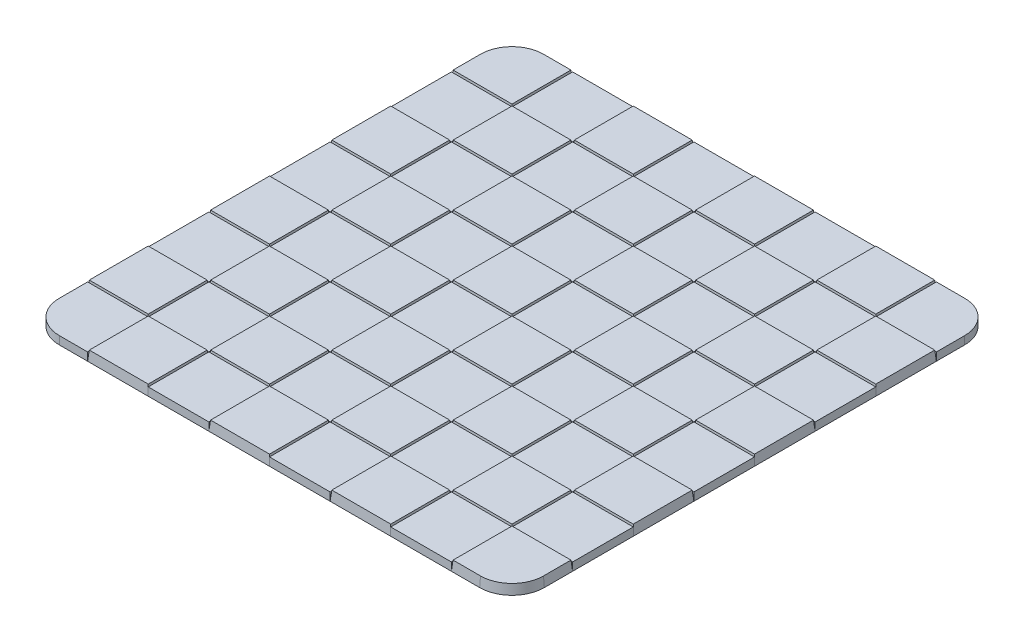
from build123d import *

# Parameters (mm, degrees)
SKETCH2_W              = 19.05
SKETCH2_H              = 19.05
BOSS_EXTRUDE1_DEPTH    = 2.54
BOSS_EXTRUDE1_2_DEPTH  = 2.54
BOSS_EXTRUDE1_3_DEPTH  = 2.54
BOSS_EXTRUDE1_4_DEPTH  = 2.54
BOSS_EXTRUDE1_5_DEPTH  = 2.54
BOSS_EXTRUDE1_6_DEPTH  = 2.54
BOSS_EXTRUDE1_7_DEPTH  = 2.54
BOSS_EXTRUDE1_8_DEPTH  = 2.54
BOSS_EXTRUDE1_9_DEPTH  = 2.54
BOSS_EXTRUDE1_10_DEPTH = 2.54
BOSS_EXTRUDE1_11_DEPTH = 2.54
BOSS_EXTRUDE1_12_DEPTH = 2.54
BOSS_EXTRUDE1_13_DEPTH = 2.54
BOSS_EXTRUDE1_14_DEPTH = 2.54
BOSS_EXTRUDE1_15_DEPTH = 2.54
BOSS_EXTRUDE1_16_DEPTH = 2.54
BOSS_EXTRUDE1_17_DEPTH = 2.54
BOSS_EXTRUDE1_18_DEPTH = 2.54
BOSS_EXTRUDE1_19_DEPTH = 2.54
BOSS_EXTRUDE1_20_DEPTH = 2.54
BOSS_EXTRUDE1_21_DEPTH = 2.54
BOSS_EXTRUDE1_22_DEPTH = 2.54
BOSS_EXTRUDE1_23_DEPTH = 2.54
BOSS_EXTRUDE1_24_DEPTH = 2.54
BOSS_EXTRUDE1_25_DEPTH = 2.54
BOSS_EXTRUDE1_26_DEPTH = 2.54
BOSS_EXTRUDE1_27_DEPTH = 2.54
BOSS_EXTRUDE1_28_DEPTH = 2.54
BOSS_EXTRUDE1_29_DEPTH = 2.54
BOSS_EXTRUDE1_30_DEPTH = 2.54
BOSS_EXTRUDE1_31_DEPTH = 2.54
BOSS_EXTRUDE1_32_DEPTH = 2.54
BOSS_EXTRUDE3_DEPTH    = 3.048
BOSS_EXTRUDE3_TAPER    = 5
SKETCH2_5_W            = 19.05
SKETCH2_5_H            = 19.05
BOSS_EXTRUDE3_2_DEPTH  = 3.048
BOSS_EXTRUDE3_2_TAPER  = 5
BOSS_EXTRUDE3_3_DEPTH  = 3.048
BOSS_EXTRUDE3_3_TAPER  = 5
BOSS_EXTRUDE3_4_DEPTH  = 3.048
BOSS_EXTRUDE3_4_TAPER  = 5
BOSS_EXTRUDE3_5_DEPTH  = 3.048
BOSS_EXTRUDE3_5_TAPER  = 5
BOSS_EXTRUDE3_6_DEPTH  = 3.048
BOSS_EXTRUDE3_6_TAPER  = 5
BOSS_EXTRUDE3_7_DEPTH  = 3.048
BOSS_EXTRUDE3_7_TAPER  = 5
BOSS_EXTRUDE3_8_DEPTH  = 3.048
BOSS_EXTRUDE3_8_TAPER  = 5
BOSS_EXTRUDE3_9_DEPTH  = 3.048
BOSS_EXTRUDE3_9_TAPER  = 5
BOSS_EXTRUDE3_10_DEPTH = 3.048
BOSS_EXTRUDE3_10_TAPER = 5
BOSS_EXTRUDE3_11_DEPTH = 3.048
BOSS_EXTRUDE3_11_TAPER = 5
BOSS_EXTRUDE3_12_DEPTH = 3.048
BOSS_EXTRUDE3_12_TAPER = 5
BOSS_EXTRUDE3_13_DEPTH = 3.048
BOSS_EXTRUDE3_13_TAPER = 5
BOSS_EXTRUDE3_14_DEPTH = 3.048
BOSS_EXTRUDE3_14_TAPER = 5
BOSS_EXTRUDE3_15_DEPTH = 3.048
BOSS_EXTRUDE3_15_TAPER = 5
BOSS_EXTRUDE3_16_DEPTH = 3.048
BOSS_EXTRUDE3_16_TAPER = 5
BOSS_EXTRUDE3_17_DEPTH = 3.048
BOSS_EXTRUDE3_17_TAPER = 5
BOSS_EXTRUDE3_18_DEPTH = 3.048
BOSS_EXTRUDE3_18_TAPER = 5
BOSS_EXTRUDE3_19_DEPTH = 3.048
BOSS_EXTRUDE3_19_TAPER = 5
BOSS_EXTRUDE3_20_DEPTH = 3.048
BOSS_EXTRUDE3_20_TAPER = 5
BOSS_EXTRUDE3_21_DEPTH = 3.048
BOSS_EXTRUDE3_21_TAPER = 5
BOSS_EXTRUDE3_22_DEPTH = 3.048
BOSS_EXTRUDE3_22_TAPER = 5
BOSS_EXTRUDE3_23_DEPTH = 3.048
BOSS_EXTRUDE3_23_TAPER = 5
BOSS_EXTRUDE3_24_DEPTH = 3.048
BOSS_EXTRUDE3_24_TAPER = 5
BOSS_EXTRUDE3_25_DEPTH = 3.048
BOSS_EXTRUDE3_25_TAPER = 5
BOSS_EXTRUDE3_26_DEPTH = 3.048
BOSS_EXTRUDE3_26_TAPER = 5
BOSS_EXTRUDE3_27_DEPTH = 3.048
BOSS_EXTRUDE3_27_TAPER = 5
BOSS_EXTRUDE3_28_DEPTH = 3.048
BOSS_EXTRUDE3_28_TAPER = 5
BOSS_EXTRUDE3_29_DEPTH = 3.048
BOSS_EXTRUDE3_29_TAPER = 5
BOSS_EXTRUDE3_30_DEPTH = 3.048
BOSS_EXTRUDE3_30_TAPER = 5
BOSS_EXTRUDE3_31_DEPTH = 3.048
BOSS_EXTRUDE3_31_TAPER = 5
BOSS_EXTRUDE3_32_DEPTH = 3.048
BOSS_EXTRUDE3_32_TAPER = 5
SCALE2_SCALE           = 2


with BuildPart() as part:
    # Sketch2 → Boss-Extrude1 (new body)
    with BuildSketch(Plane(origin=(0, 0, 0), x_dir=(1, 0, 0), z_dir=(0, 1, 0))):
        with Locations((-47.625, 66.675)):
            Rectangle(SKETCH2_W, SKETCH2_H)
    extrude(amount=BOSS_EXTRUDE1_DEPTH)


with BuildPart() as body_2:
    # Sketch2 → Boss-Extrude1 2 (new body)
    with BuildSketch(Plane(origin=(0, 0, 0), x_dir=(1, 0, 0), z_dir=(0, 1, 0))):
        with Locations((-66.675, 47.625)):
            Rectangle(SKETCH2_W, SKETCH2_H)
    extrude(amount=BOSS_EXTRUDE1_2_DEPTH)


with BuildPart() as body_3:
    # Sketch2 → Boss-Extrude1 3 (new body)
    with BuildSketch(Plane(origin=(0, 0, 0), x_dir=(1, 0, 0), z_dir=(0, 1, 0))):
        with Locations((-28.575, 47.625)):
            Rectangle(SKETCH2_W, SKETCH2_H)
    extrude(amount=BOSS_EXTRUDE1_3_DEPTH)


with BuildPart() as body_4:
    # Sketch2 → Boss-Extrude1 4 (new body)
    with BuildSketch(Plane(origin=(0, 0, 0), x_dir=(1, 0, 0), z_dir=(0, 1, 0))):
        with Locations((-47.625, 28.575)):
            Rectangle(SKETCH2_W, SKETCH2_H)
    extrude(amount=BOSS_EXTRUDE1_4_DEPTH)


with BuildPart() as body_5:
    # Sketch2 → Boss-Extrude1 5 (new body)
    with BuildSketch(Plane(origin=(0, 0, 0), x_dir=(1, 0, 0), z_dir=(0, 1, 0))):
        with Locations((-9.525, 66.675)):
            Rectangle(SKETCH2_W, SKETCH2_H)
    extrude(amount=BOSS_EXTRUDE1_5_DEPTH)


with BuildPart() as body_6:
    # Sketch2 → Boss-Extrude1 6 (new body)
    with BuildSketch(Plane(origin=(0, 0, 0), x_dir=(1, 0, 0), z_dir=(0, 1, 0))):
        with Locations((-66.675, 9.525)):
            Rectangle(SKETCH2_W, SKETCH2_H)
    extrude(amount=BOSS_EXTRUDE1_6_DEPTH)


with BuildPart() as body_7:
    # Sketch2 → Boss-Extrude1 7 (new body)
    with BuildSketch(Plane(origin=(0, 0, 0), x_dir=(1, 0, 0), z_dir=(0, 1, 0))):
        with Locations((9.525, 47.625)):
            Rectangle(SKETCH2_W, SKETCH2_H)
    extrude(amount=BOSS_EXTRUDE1_7_DEPTH)


with BuildPart() as body_8:
    # Sketch2 → Boss-Extrude1 8 (new body)
    with BuildSketch(Plane(origin=(0, 0, 0), x_dir=(1, 0, 0), z_dir=(0, 1, 0))):
        with Locations((-9.525, 28.575)):
            Rectangle(SKETCH2_W, SKETCH2_H)
    extrude(amount=BOSS_EXTRUDE1_8_DEPTH)


with BuildPart() as body_9:
    # Sketch2 → Boss-Extrude1 9 (new body)
    with BuildSketch(Plane(origin=(0, 0, 0), x_dir=(1, 0, 0), z_dir=(0, 1, 0))):
        with Locations((-28.575, 9.525)):
            Rectangle(SKETCH2_W, SKETCH2_H)
    extrude(amount=BOSS_EXTRUDE1_9_DEPTH)


with BuildPart() as body_10:
    # Sketch2 → Boss-Extrude1 10 (new body)
    with BuildSketch(Plane(origin=(0, 0, 0), x_dir=(1, 0, 0), z_dir=(0, 1, 0))):
        with Locations((-47.625, -9.525)):
            Rectangle(SKETCH2_W, SKETCH2_H)
    extrude(amount=BOSS_EXTRUDE1_10_DEPTH)


with BuildPart() as body_11:
    # Sketch2 → Boss-Extrude1 11 (new body)
    with BuildSketch(Plane(origin=(0, 0, 0), x_dir=(1, 0, 0), z_dir=(0, 1, 0))):
        with Locations((28.575, 66.675)):
            Rectangle(SKETCH2_W, SKETCH2_H)
    extrude(amount=BOSS_EXTRUDE1_11_DEPTH)


with BuildPart() as body_12:
    # Sketch2 → Boss-Extrude1 12 (new body)
    with BuildSketch(Plane(origin=(0, 0, 0), x_dir=(1, 0, 0), z_dir=(0, 1, 0))):
        with Locations((-66.675, -28.575)):
            Rectangle(SKETCH2_W, SKETCH2_H)
    extrude(amount=BOSS_EXTRUDE1_12_DEPTH)


with BuildPart() as body_13:
    # Sketch2 → Boss-Extrude1 13 (new body)
    with BuildSketch(Plane(origin=(0, 0, 0), x_dir=(1, 0, 0), z_dir=(0, 1, 0))):
        with Locations((47.625, 47.625)):
            Rectangle(SKETCH2_W, SKETCH2_H)
    extrude(amount=BOSS_EXTRUDE1_13_DEPTH)


with BuildPart() as body_14:
    # Sketch2 → Boss-Extrude1 14 (new body)
    with BuildSketch(Plane(origin=(0, 0, 0), x_dir=(1, 0, 0), z_dir=(0, 1, 0))):
        with Locations((28.575, 28.575)):
            Rectangle(SKETCH2_W, SKETCH2_H)
    extrude(amount=BOSS_EXTRUDE1_14_DEPTH)


with BuildPart() as body_15:
    # Sketch2 → Boss-Extrude1 15 (new body)
    with BuildSketch(Plane(origin=(0, 0, 0), x_dir=(1, 0, 0), z_dir=(0, 1, 0))):
        with Locations((9.525, 9.525)):
            Rectangle(SKETCH2_W, SKETCH2_H)
    extrude(amount=BOSS_EXTRUDE1_15_DEPTH)


with BuildPart() as body_16:
    # Sketch2 → Boss-Extrude1 16 (new body)
    with BuildSketch(Plane(origin=(0, 0, 0), x_dir=(1, 0, 0), z_dir=(0, 1, 0))):
        with Locations((-9.525, -9.525)):
            Rectangle(SKETCH2_W, SKETCH2_H)
    extrude(amount=BOSS_EXTRUDE1_16_DEPTH)


with BuildPart() as body_17:
    # Sketch2 → Boss-Extrude1 17 (new body)
    with BuildSketch(Plane(origin=(0, 0, 0), x_dir=(1, 0, 0), z_dir=(0, 1, 0))):
        with Locations((-28.575, -28.575)):
            Rectangle(SKETCH2_W, SKETCH2_H)
    extrude(amount=BOSS_EXTRUDE1_17_DEPTH)


with BuildPart() as body_18:
    # Sketch2 → Boss-Extrude1 18 (new body)
    with BuildSketch(Plane(origin=(0, 0, 0), x_dir=(1, 0, 0), z_dir=(0, 1, 0))):
        with Locations((-47.625, -47.625)):
            Rectangle(SKETCH2_W, SKETCH2_H)
    extrude(amount=BOSS_EXTRUDE1_18_DEPTH)


with BuildPart() as body_19:
    # Sketch2 → Boss-Extrude1 19 (new body)
    with BuildSketch(Plane(origin=(0, 0, 0), x_dir=(1, 0, 0), z_dir=(0, 1, 0))):
        with BuildLine():
            Line((57.15, 76.2), (57.15, 57.15))
            Line((57.15, 57.15), (76.2, 57.15))
            Line((76.2, 57.15), (76.2, 66.04))
            ThreePointArc((76.2, 66.04), (73.224204897, 73.224204897), (66.04, 76.2))
            Line((66.04, 76.2), (57.15, 76.2))
        make_face()
    extrude(amount=BOSS_EXTRUDE1_19_DEPTH)


with BuildPart() as body_20:
    # Sketch2 → Boss-Extrude1 20 (new body)
    with BuildSketch(Plane(origin=(0, 0, 0), x_dir=(1, 0, 0), z_dir=(0, 1, 0))):
        with BuildLine():
            Line((-57.15, -76.2), (-57.15, -57.15))
            Line((-57.15, -57.15), (-76.2, -57.15))
            Line((-76.2, -57.15), (-76.2, -66.04))
            ThreePointArc((-76.2, -66.04), (-73.224204897, -73.224204897), (-66.04, -76.2))
            Line((-66.04, -76.2), (-57.15, -76.2))
        make_face()
    extrude(amount=BOSS_EXTRUDE1_20_DEPTH)


with BuildPart() as body_21:
    # Sketch2 → Boss-Extrude1 21 (new body)
    with BuildSketch(Plane(origin=(0, 0, 0), x_dir=(1, 0, 0), z_dir=(0, 1, 0))):
        with Locations((66.675, 28.575)):
            Rectangle(SKETCH2_W, SKETCH2_H)
    extrude(amount=BOSS_EXTRUDE1_21_DEPTH)


with BuildPart() as body_22:
    # Sketch2 → Boss-Extrude1 22 (new body)
    with BuildSketch(Plane(origin=(0, 0, 0), x_dir=(1, 0, 0), z_dir=(0, 1, 0))):
        with Locations((47.625, 9.525)):
            Rectangle(SKETCH2_W, SKETCH2_H)
    extrude(amount=BOSS_EXTRUDE1_22_DEPTH)


with BuildPart() as body_23:
    # Sketch2 → Boss-Extrude1 23 (new body)
    with BuildSketch(Plane(origin=(0, 0, 0), x_dir=(1, 0, 0), z_dir=(0, 1, 0))):
        with Locations((28.575, -9.525)):
            Rectangle(SKETCH2_W, SKETCH2_H)
    extrude(amount=BOSS_EXTRUDE1_23_DEPTH)


with BuildPart() as body_24:
    # Sketch2 → Boss-Extrude1 24 (new body)
    with BuildSketch(Plane(origin=(0, 0, 0), x_dir=(1, 0, 0), z_dir=(0, 1, 0))):
        with Locations((9.525, -28.575)):
            Rectangle(SKETCH2_W, SKETCH2_H)
    extrude(amount=BOSS_EXTRUDE1_24_DEPTH)


with BuildPart() as body_25:
    # Sketch2 → Boss-Extrude1 25 (new body)
    with BuildSketch(Plane(origin=(0, 0, 0), x_dir=(1, 0, 0), z_dir=(0, 1, 0))):
        with Locations((-9.525, -47.625)):
            Rectangle(SKETCH2_W, SKETCH2_H)
    extrude(amount=BOSS_EXTRUDE1_25_DEPTH)


with BuildPart() as body_26:
    # Sketch2 → Boss-Extrude1 26 (new body)
    with BuildSketch(Plane(origin=(0, 0, 0), x_dir=(1, 0, 0), z_dir=(0, 1, 0))):
        with Locations((-28.575, -66.675)):
            Rectangle(SKETCH2_W, SKETCH2_H)
    extrude(amount=BOSS_EXTRUDE1_26_DEPTH)


with BuildPart() as body_27:
    # Sketch2 → Boss-Extrude1 27 (new body)
    with BuildSketch(Plane(origin=(0, 0, 0), x_dir=(1, 0, 0), z_dir=(0, 1, 0))):
        with Locations((66.675, -9.525)):
            Rectangle(SKETCH2_W, SKETCH2_H)
    extrude(amount=BOSS_EXTRUDE1_27_DEPTH)


with BuildPart() as body_28:
    # Sketch2 → Boss-Extrude1 28 (new body)
    with BuildSketch(Plane(origin=(0, 0, 0), x_dir=(1, 0, 0), z_dir=(0, 1, 0))):
        with Locations((47.625, -28.575)):
            Rectangle(SKETCH2_W, SKETCH2_H)
    extrude(amount=BOSS_EXTRUDE1_28_DEPTH)


with BuildPart() as body_29:
    # Sketch2 → Boss-Extrude1 29 (new body)
    with BuildSketch(Plane(origin=(0, 0, 0), x_dir=(1, 0, 0), z_dir=(0, 1, 0))):
        with Locations((28.575, -47.625)):
            Rectangle(SKETCH2_W, SKETCH2_H)
    extrude(amount=BOSS_EXTRUDE1_29_DEPTH)


with BuildPart() as body_30:
    # Sketch2 → Boss-Extrude1 30 (new body)
    with BuildSketch(Plane(origin=(0, 0, 0), x_dir=(1, 0, 0), z_dir=(0, 1, 0))):
        with Locations((9.525, -66.675)):
            Rectangle(SKETCH2_W, SKETCH2_H)
    extrude(amount=BOSS_EXTRUDE1_30_DEPTH)


with BuildPart() as body_31:
    # Sketch2 → Boss-Extrude1 31 (new body)
    with BuildSketch(Plane(origin=(0, 0, 0), x_dir=(1, 0, 0), z_dir=(0, 1, 0))):
        with Locations((66.675, -47.625)):
            Rectangle(SKETCH2_W, SKETCH2_H)
    extrude(amount=BOSS_EXTRUDE1_31_DEPTH)


with BuildPart() as body_32:
    # Sketch2 → Boss-Extrude1 32 (new body)
    with BuildSketch(Plane(origin=(0, 0, 0), x_dir=(1, 0, 0), z_dir=(0, 1, 0))):
        with Locations((47.625, -66.675)):
            Rectangle(SKETCH2_W, SKETCH2_H)
    extrude(amount=BOSS_EXTRUDE1_32_DEPTH)


with BuildPart() as body_33:
    # Sketch2<5> → Boss-Extrude3 (new body)
    with BuildSketch(Plane(origin=(0, 0, 0), x_dir=(1, 0, 0), z_dir=(0, 1, 0))):
        with BuildLine():
            Line((-76.2, 57.15), (-57.15, 57.15))
            Line((-57.15, 57.15), (-57.15, 76.2))
            Line((-57.15, 76.2), (-66.04, 76.2))
            ThreePointArc((-66.04, 76.2), (-73.224204897, 73.224204897), (-76.2, 66.04))
            Line((-76.2, 66.04), (-76.2, 57.15))
        make_face()
    extrude(amount=BOSS_EXTRUDE3_DEPTH, taper=BOSS_EXTRUDE3_TAPER)


with BuildPart() as body_34:
    # Sketch2<5> → Boss-Extrude3 2 (new body)
    with BuildSketch(Plane(origin=(0, 0, 0), x_dir=(1, 0, 0), z_dir=(0, 1, 0))):
        with Locations((-47.625, 47.625)):
            Rectangle(SKETCH2_5_W, SKETCH2_5_H)
    extrude(amount=BOSS_EXTRUDE3_2_DEPTH, taper=BOSS_EXTRUDE3_2_TAPER)


with BuildPart() as body_35:
    # Sketch2<5> → Boss-Extrude3 3 (new body)
    with BuildSketch(Plane(origin=(0, 0, 0), x_dir=(1, 0, 0), z_dir=(0, 1, 0))):
        with Locations((-28.575, 66.675)):
            Rectangle(SKETCH2_5_W, SKETCH2_5_H)
    extrude(amount=BOSS_EXTRUDE3_3_DEPTH, taper=BOSS_EXTRUDE3_3_TAPER)


with BuildPart() as body_36:
    # Sketch2<5> → Boss-Extrude3 4 (new body)
    with BuildSketch(Plane(origin=(0, 0, 0), x_dir=(1, 0, 0), z_dir=(0, 1, 0))):
        with Locations((-66.675, 28.575)):
            Rectangle(SKETCH2_5_W, SKETCH2_5_H)
    extrude(amount=BOSS_EXTRUDE3_4_DEPTH, taper=BOSS_EXTRUDE3_4_TAPER)


with BuildPart() as body_37:
    # Sketch2<5> → Boss-Extrude3 5 (new body)
    with BuildSketch(Plane(origin=(0, 0, 0), x_dir=(1, 0, 0), z_dir=(0, 1, 0))):
        with Locations((-9.525, 47.625)):
            Rectangle(SKETCH2_5_W, SKETCH2_5_H)
    extrude(amount=BOSS_EXTRUDE3_5_DEPTH, taper=BOSS_EXTRUDE3_5_TAPER)


with BuildPart() as body_38:
    # Sketch2<5> → Boss-Extrude3 6 (new body)
    with BuildSketch(Plane(origin=(0, 0, 0), x_dir=(1, 0, 0), z_dir=(0, 1, 0))):
        with Locations((-28.575, 28.575)):
            Rectangle(SKETCH2_5_W, SKETCH2_5_H)
    extrude(amount=BOSS_EXTRUDE3_6_DEPTH, taper=BOSS_EXTRUDE3_6_TAPER)


with BuildPart() as body_39:
    # Sketch2<5> → Boss-Extrude3 7 (new body)
    with BuildSketch(Plane(origin=(0, 0, 0), x_dir=(1, 0, 0), z_dir=(0, 1, 0))):
        with Locations((-47.625, 9.525)):
            Rectangle(SKETCH2_5_W, SKETCH2_5_H)
    extrude(amount=BOSS_EXTRUDE3_7_DEPTH, taper=BOSS_EXTRUDE3_7_TAPER)


with BuildPart() as body_40:
    # Sketch2<5> → Boss-Extrude3 8 (new body)
    with BuildSketch(Plane(origin=(0, 0, 0), x_dir=(1, 0, 0), z_dir=(0, 1, 0))):
        with Locations((9.525, 66.675)):
            Rectangle(SKETCH2_5_W, SKETCH2_5_H)
    extrude(amount=BOSS_EXTRUDE3_8_DEPTH, taper=BOSS_EXTRUDE3_8_TAPER)


with BuildPart() as body_41:
    # Sketch2<5> → Boss-Extrude3 9 (new body)
    with BuildSketch(Plane(origin=(0, 0, 0), x_dir=(1, 0, 0), z_dir=(0, 1, 0))):
        with Locations((-66.675, -9.525)):
            Rectangle(SKETCH2_5_W, SKETCH2_5_H)
    extrude(amount=BOSS_EXTRUDE3_9_DEPTH, taper=BOSS_EXTRUDE3_9_TAPER)


with BuildPart() as body_42:
    # Sketch2<5> → Boss-Extrude3 10 (new body)
    with BuildSketch(Plane(origin=(0, 0, 0), x_dir=(1, 0, 0), z_dir=(0, 1, 0))):
        with Locations((28.575, 47.625)):
            Rectangle(SKETCH2_5_W, SKETCH2_5_H)
    extrude(amount=BOSS_EXTRUDE3_10_DEPTH, taper=BOSS_EXTRUDE3_10_TAPER)


with BuildPart() as body_43:
    # Sketch2<5> → Boss-Extrude3 11 (new body)
    with BuildSketch(Plane(origin=(0, 0, 0), x_dir=(1, 0, 0), z_dir=(0, 1, 0))):
        with Locations((9.525, 28.575)):
            Rectangle(SKETCH2_5_W, SKETCH2_5_H)
    extrude(amount=BOSS_EXTRUDE3_11_DEPTH, taper=BOSS_EXTRUDE3_11_TAPER)


with BuildPart() as body_44:
    # Sketch2<5> → Boss-Extrude3 12 (new body)
    with BuildSketch(Plane(origin=(0, 0, 0), x_dir=(1, 0, 0), z_dir=(0, 1, 0))):
        with Locations((-9.525, 9.525)):
            Rectangle(SKETCH2_5_W, SKETCH2_5_H)
    extrude(amount=BOSS_EXTRUDE3_12_DEPTH, taper=BOSS_EXTRUDE3_12_TAPER)


with BuildPart() as body_45:
    # Sketch2<5> → Boss-Extrude3 13 (new body)
    with BuildSketch(Plane(origin=(0, 0, 0), x_dir=(1, 0, 0), z_dir=(0, 1, 0))):
        with Locations((-28.575, -9.525)):
            Rectangle(SKETCH2_5_W, SKETCH2_5_H)
    extrude(amount=BOSS_EXTRUDE3_13_DEPTH, taper=BOSS_EXTRUDE3_13_TAPER)


with BuildPart() as body_46:
    # Sketch2<5> → Boss-Extrude3 14 (new body)
    with BuildSketch(Plane(origin=(0, 0, 0), x_dir=(1, 0, 0), z_dir=(0, 1, 0))):
        with Locations((-47.625, -28.575)):
            Rectangle(SKETCH2_5_W, SKETCH2_5_H)
    extrude(amount=BOSS_EXTRUDE3_14_DEPTH, taper=BOSS_EXTRUDE3_14_TAPER)


with BuildPart() as body_47:
    # Sketch2<5> → Boss-Extrude3 15 (new body)
    with BuildSketch(Plane(origin=(0, 0, 0), x_dir=(1, 0, 0), z_dir=(0, 1, 0))):
        with Locations((47.625, 66.675)):
            Rectangle(SKETCH2_5_W, SKETCH2_5_H)
    extrude(amount=BOSS_EXTRUDE3_15_DEPTH, taper=BOSS_EXTRUDE3_15_TAPER)


with BuildPart() as body_48:
    # Sketch2<5> → Boss-Extrude3 16 (new body)
    with BuildSketch(Plane(origin=(0, 0, 0), x_dir=(1, 0, 0), z_dir=(0, 1, 0))):
        with Locations((-66.675, -47.625)):
            Rectangle(SKETCH2_5_W, SKETCH2_5_H)
    extrude(amount=BOSS_EXTRUDE3_16_DEPTH, taper=BOSS_EXTRUDE3_16_TAPER)


with BuildPart() as body_49:
    # Sketch2<5> → Boss-Extrude3 17 (new body)
    with BuildSketch(Plane(origin=(0, 0, 0), x_dir=(1, 0, 0), z_dir=(0, 1, 0))):
        with Locations((66.675, 47.625)):
            Rectangle(SKETCH2_5_W, SKETCH2_5_H)
    extrude(amount=BOSS_EXTRUDE3_17_DEPTH, taper=BOSS_EXTRUDE3_17_TAPER)


with BuildPart() as body_50:
    # Sketch2<5> → Boss-Extrude3 18 (new body)
    with BuildSketch(Plane(origin=(0, 0, 0), x_dir=(1, 0, 0), z_dir=(0, 1, 0))):
        with Locations((47.625, 28.575)):
            Rectangle(SKETCH2_5_W, SKETCH2_5_H)
    extrude(amount=BOSS_EXTRUDE3_18_DEPTH, taper=BOSS_EXTRUDE3_18_TAPER)


with BuildPart() as body_51:
    # Sketch2<5> → Boss-Extrude3 19 (new body)
    with BuildSketch(Plane(origin=(0, 0, 0), x_dir=(1, 0, 0), z_dir=(0, 1, 0))):
        with Locations((28.575, 9.525)):
            Rectangle(SKETCH2_5_W, SKETCH2_5_H)
    extrude(amount=BOSS_EXTRUDE3_19_DEPTH, taper=BOSS_EXTRUDE3_19_TAPER)


with BuildPart() as body_52:
    # Sketch2<5> → Boss-Extrude3 20 (new body)
    with BuildSketch(Plane(origin=(0, 0, 0), x_dir=(1, 0, 0), z_dir=(0, 1, 0))):
        with Locations((9.525, -9.525)):
            Rectangle(SKETCH2_5_W, SKETCH2_5_H)
    extrude(amount=BOSS_EXTRUDE3_20_DEPTH, taper=BOSS_EXTRUDE3_20_TAPER)


with BuildPart() as body_53:
    # Sketch2<5> → Boss-Extrude3 21 (new body)
    with BuildSketch(Plane(origin=(0, 0, 0), x_dir=(1, 0, 0), z_dir=(0, 1, 0))):
        with Locations((-9.525, -28.575)):
            Rectangle(SKETCH2_5_W, SKETCH2_5_H)
    extrude(amount=BOSS_EXTRUDE3_21_DEPTH, taper=BOSS_EXTRUDE3_21_TAPER)


with BuildPart() as body_54:
    # Sketch2<5> → Boss-Extrude3 22 (new body)
    with BuildSketch(Plane(origin=(0, 0, 0), x_dir=(1, 0, 0), z_dir=(0, 1, 0))):
        with Locations((-28.575, -47.625)):
            Rectangle(SKETCH2_5_W, SKETCH2_5_H)
    extrude(amount=BOSS_EXTRUDE3_22_DEPTH, taper=BOSS_EXTRUDE3_22_TAPER)


with BuildPart() as body_55:
    # Sketch2<5> → Boss-Extrude3 23 (new body)
    with BuildSketch(Plane(origin=(0, 0, 0), x_dir=(1, 0, 0), z_dir=(0, 1, 0))):
        with Locations((-47.625, -66.675)):
            Rectangle(SKETCH2_5_W, SKETCH2_5_H)
    extrude(amount=BOSS_EXTRUDE3_23_DEPTH, taper=BOSS_EXTRUDE3_23_TAPER)


with BuildPart() as body_56:
    # Sketch2<5> → Boss-Extrude3 24 (new body)
    with BuildSketch(Plane(origin=(0, 0, 0), x_dir=(1, 0, 0), z_dir=(0, 1, 0))):
        with Locations((66.675, 9.525)):
            Rectangle(SKETCH2_5_W, SKETCH2_5_H)
    extrude(amount=BOSS_EXTRUDE3_24_DEPTH, taper=BOSS_EXTRUDE3_24_TAPER)


with BuildPart() as body_57:
    # Sketch2<5> → Boss-Extrude3 25 (new body)
    with BuildSketch(Plane(origin=(0, 0, 0), x_dir=(1, 0, 0), z_dir=(0, 1, 0))):
        with Locations((47.625, -9.525)):
            Rectangle(SKETCH2_5_W, SKETCH2_5_H)
    extrude(amount=BOSS_EXTRUDE3_25_DEPTH, taper=BOSS_EXTRUDE3_25_TAPER)


with BuildPart() as body_58:
    # Sketch2<5> → Boss-Extrude3 26 (new body)
    with BuildSketch(Plane(origin=(0, 0, 0), x_dir=(1, 0, 0), z_dir=(0, 1, 0))):
        with Locations((28.575, -28.575)):
            Rectangle(SKETCH2_5_W, SKETCH2_5_H)
    extrude(amount=BOSS_EXTRUDE3_26_DEPTH, taper=BOSS_EXTRUDE3_26_TAPER)


with BuildPart() as body_59:
    # Sketch2<5> → Boss-Extrude3 27 (new body)
    with BuildSketch(Plane(origin=(0, 0, 0), x_dir=(1, 0, 0), z_dir=(0, 1, 0))):
        with Locations((9.525, -47.625)):
            Rectangle(SKETCH2_5_W, SKETCH2_5_H)
    extrude(amount=BOSS_EXTRUDE3_27_DEPTH, taper=BOSS_EXTRUDE3_27_TAPER)


with BuildPart() as body_60:
    # Sketch2<5> → Boss-Extrude3 28 (new body)
    with BuildSketch(Plane(origin=(0, 0, 0), x_dir=(1, 0, 0), z_dir=(0, 1, 0))):
        with Locations((-9.525, -66.675)):
            Rectangle(SKETCH2_5_W, SKETCH2_5_H)
    extrude(amount=BOSS_EXTRUDE3_28_DEPTH, taper=BOSS_EXTRUDE3_28_TAPER)


with BuildPart() as body_61:
    # Sketch2<5> → Boss-Extrude3 29 (new body)
    with BuildSketch(Plane(origin=(0, 0, 0), x_dir=(1, 0, 0), z_dir=(0, 1, 0))):
        with Locations((66.675, -28.575)):
            Rectangle(SKETCH2_5_W, SKETCH2_5_H)
    extrude(amount=BOSS_EXTRUDE3_29_DEPTH, taper=BOSS_EXTRUDE3_29_TAPER)


with BuildPart() as body_62:
    # Sketch2<5> → Boss-Extrude3 30 (new body)
    with BuildSketch(Plane(origin=(0, 0, 0), x_dir=(1, 0, 0), z_dir=(0, 1, 0))):
        with Locations((47.625, -47.625)):
            Rectangle(SKETCH2_5_W, SKETCH2_5_H)
    extrude(amount=BOSS_EXTRUDE3_30_DEPTH, taper=BOSS_EXTRUDE3_30_TAPER)


with BuildPart() as body_63:
    # Sketch2<5> → Boss-Extrude3 31 (new body)
    with BuildSketch(Plane(origin=(0, 0, 0), x_dir=(1, 0, 0), z_dir=(0, 1, 0))):
        with Locations((28.575, -66.675)):
            Rectangle(SKETCH2_5_W, SKETCH2_5_H)
    extrude(amount=BOSS_EXTRUDE3_31_DEPTH, taper=BOSS_EXTRUDE3_31_TAPER)


with BuildPart() as body_64:
    # Sketch2<5> → Boss-Extrude3 32 (new body)
    with BuildSketch(Plane(origin=(0, 0, 0), x_dir=(1, 0, 0), z_dir=(0, 1, 0))):
        with BuildLine():
            Line((76.2, -57.15), (57.15, -57.15))
            Line((57.15, -57.15), (57.15, -76.2))
            Line((57.15, -76.2), (66.04, -76.2))
            ThreePointArc((66.04, -76.2), (73.224204897, -73.224204897), (76.2, -66.04))
            Line((76.2, -66.04), (76.2, -57.15))
        make_face()
    extrude(amount=BOSS_EXTRUDE3_32_DEPTH, taper=BOSS_EXTRUDE3_32_TAPER)


with BuildPart() as body_63_1:
    # Scale2: scaled about (0, 0, 0)
    add(body_63.part.scale(SCALE2_SCALE))


with BuildPart() as body_64_1:
    # Scale2: scaled about (0, 0, 0)
    add(body_64.part.scale(SCALE2_SCALE))


with BuildPart() as body_44_1:
    # Scale2: scaled about (0, 0, 0)
    add(body_44.part.scale(SCALE2_SCALE))


with BuildPart() as body_47_1:
    # Scale2: scaled about (0, 0, 0)
    add(body_47.part.scale(SCALE2_SCALE))


with BuildPart() as body_32_1:
    # Scale2: scaled about (0, 0, 0)
    add(body_32.part.scale(SCALE2_SCALE))


with BuildPart() as body_5_1:
    # Scale2: scaled about (0, 0, 0)
    add(body_5.part.scale(SCALE2_SCALE))


with BuildPart() as body_41_1:
    # Scale2: scaled about (0, 0, 0)
    add(body_41.part.scale(SCALE2_SCALE))


with BuildPart() as body_23_1:
    # Scale2: scaled about (0, 0, 0)
    add(body_23.part.scale(SCALE2_SCALE))


with BuildPart() as body_51_1:
    # Scale2: scaled about (0, 0, 0)
    add(body_51.part.scale(SCALE2_SCALE))


with BuildPart() as body_46_1:
    # Scale2: scaled about (0, 0, 0)
    add(body_46.part.scale(SCALE2_SCALE))


with BuildPart() as body_56_1:
    # Scale2: scaled about (0, 0, 0)
    add(body_56.part.scale(SCALE2_SCALE))


with BuildPart() as body_8_1:
    # Scale2: scaled about (0, 0, 0)
    add(body_8.part.scale(SCALE2_SCALE))


with BuildPart() as body_17_1:
    # Scale2: scaled about (0, 0, 0)
    add(body_17.part.scale(SCALE2_SCALE))


with BuildPart() as body_61_1:
    # Scale2: scaled about (0, 0, 0)
    add(body_61.part.scale(SCALE2_SCALE))


with BuildPart() as body_49_1:
    # Scale2: scaled about (0, 0, 0)
    add(body_49.part.scale(SCALE2_SCALE))


with BuildPart() as body_29_1:
    # Scale2: scaled about (0, 0, 0)
    add(body_29.part.scale(SCALE2_SCALE))


with BuildPart() as body_31_1:
    # Scale2: scaled about (0, 0, 0)
    add(body_31.part.scale(SCALE2_SCALE))


with BuildPart() as body_22_1:
    # Scale2: scaled about (0, 0, 0)
    add(body_22.part.scale(SCALE2_SCALE))


with BuildPart() as body_12_1:
    # Scale2: scaled about (0, 0, 0)
    add(body_12.part.scale(SCALE2_SCALE))


with BuildPart() as body_35_1:
    # Scale2: scaled about (0, 0, 0)
    add(body_35.part.scale(SCALE2_SCALE))


with BuildPart() as body_3_1:
    # Scale2: scaled about (0, 0, 0)
    add(body_3.part.scale(SCALE2_SCALE))


with BuildPart() as body_45_1:
    # Scale2: scaled about (0, 0, 0)
    add(body_45.part.scale(SCALE2_SCALE))


with BuildPart() as part_1:
    # Scale2: scaled about (0, 0, 0)
    add(part.part.scale(SCALE2_SCALE))


with BuildPart() as body_36_1:
    # Scale2: scaled about (0, 0, 0)
    add(body_36.part.scale(SCALE2_SCALE))


with BuildPart() as body_38_1:
    # Scale2: scaled about (0, 0, 0)
    add(body_38.part.scale(SCALE2_SCALE))


with BuildPart() as body_10_1:
    # Scale2: scaled about (0, 0, 0)
    add(body_10.part.scale(SCALE2_SCALE))


with BuildPart() as body_27_1:
    # Scale2: scaled about (0, 0, 0)
    add(body_27.part.scale(SCALE2_SCALE))


with BuildPart() as body_20_1:
    # Scale2: scaled about (0, 0, 0)
    add(body_20.part.scale(SCALE2_SCALE))


with BuildPart() as body_52_1:
    # Scale2: scaled about (0, 0, 0)
    add(body_52.part.scale(SCALE2_SCALE))


with BuildPart() as body_33_1:
    # Scale2: scaled about (0, 0, 0)
    add(body_33.part.scale(SCALE2_SCALE))


with BuildPart() as body_50_1:
    # Scale2: scaled about (0, 0, 0)
    add(body_50.part.scale(SCALE2_SCALE))


with BuildPart() as body_48_1:
    # Scale2: scaled about (0, 0, 0)
    add(body_48.part.scale(SCALE2_SCALE))


with BuildPart() as body_4_1:
    # Scale2: scaled about (0, 0, 0)
    add(body_4.part.scale(SCALE2_SCALE))


with BuildPart() as body_57_1:
    # Scale2: scaled about (0, 0, 0)
    add(body_57.part.scale(SCALE2_SCALE))


with BuildPart() as body_18_1:
    # Scale2: scaled about (0, 0, 0)
    add(body_18.part.scale(SCALE2_SCALE))


with BuildPart() as body_25_1:
    # Scale2: scaled about (0, 0, 0)
    add(body_25.part.scale(SCALE2_SCALE))


with BuildPart() as body_28_1:
    # Scale2: scaled about (0, 0, 0)
    add(body_28.part.scale(SCALE2_SCALE))


with BuildPart() as body_21_1:
    # Scale2: scaled about (0, 0, 0)
    add(body_21.part.scale(SCALE2_SCALE))


with BuildPart() as body_43_1:
    # Scale2: scaled about (0, 0, 0)
    add(body_43.part.scale(SCALE2_SCALE))


with BuildPart() as body_9_1:
    # Scale2: scaled about (0, 0, 0)
    add(body_9.part.scale(SCALE2_SCALE))


with BuildPart() as body_59_1:
    # Scale2: scaled about (0, 0, 0)
    add(body_59.part.scale(SCALE2_SCALE))


with BuildPart() as body_54_1:
    # Scale2: scaled about (0, 0, 0)
    add(body_54.part.scale(SCALE2_SCALE))


with BuildPart() as body_2_1:
    # Scale2: scaled about (0, 0, 0)
    add(body_2.part.scale(SCALE2_SCALE))


with BuildPart() as body_37_1:
    # Scale2: scaled about (0, 0, 0)
    add(body_37.part.scale(SCALE2_SCALE))


with BuildPart() as body_13_1:
    # Scale2: scaled about (0, 0, 0)
    add(body_13.part.scale(SCALE2_SCALE))


with BuildPart() as body_26_1:
    # Scale2: scaled about (0, 0, 0)
    add(body_26.part.scale(SCALE2_SCALE))


with BuildPart() as body_53_1:
    # Scale2: scaled about (0, 0, 0)
    add(body_53.part.scale(SCALE2_SCALE))


with BuildPart() as body_42_1:
    # Scale2: scaled about (0, 0, 0)
    add(body_42.part.scale(SCALE2_SCALE))


with BuildPart() as body_19_1:
    # Scale2: scaled about (0, 0, 0)
    add(body_19.part.scale(SCALE2_SCALE))


with BuildPart() as body_11_1:
    # Scale2: scaled about (0, 0, 0)
    add(body_11.part.scale(SCALE2_SCALE))


with BuildPart() as body_39_1:
    # Scale2: scaled about (0, 0, 0)
    add(body_39.part.scale(SCALE2_SCALE))


with BuildPart() as body_14_1:
    # Scale2: scaled about (0, 0, 0)
    add(body_14.part.scale(SCALE2_SCALE))


with BuildPart() as body_58_1:
    # Scale2: scaled about (0, 0, 0)
    add(body_58.part.scale(SCALE2_SCALE))


with BuildPart() as body_16_1:
    # Scale2: scaled about (0, 0, 0)
    add(body_16.part.scale(SCALE2_SCALE))


with BuildPart() as body_60_1:
    # Scale2: scaled about (0, 0, 0)
    add(body_60.part.scale(SCALE2_SCALE))


with BuildPart() as body_55_1:
    # Scale2: scaled about (0, 0, 0)
    add(body_55.part.scale(SCALE2_SCALE))


with BuildPart() as body_24_1:
    # Scale2: scaled about (0, 0, 0)
    add(body_24.part.scale(SCALE2_SCALE))


with BuildPart() as body_30_1:
    # Scale2: scaled about (0, 0, 0)
    add(body_30.part.scale(SCALE2_SCALE))


with BuildPart() as body_40_1:
    # Scale2: scaled about (0, 0, 0)
    add(body_40.part.scale(SCALE2_SCALE))


with BuildPart() as body_15_1:
    # Scale2: scaled about (0, 0, 0)
    add(body_15.part.scale(SCALE2_SCALE))


with BuildPart() as body_6_1:
    # Scale2: scaled about (0, 0, 0)
    add(body_6.part.scale(SCALE2_SCALE))


with BuildPart() as body_62_1:
    # Scale2: scaled about (0, 0, 0)
    add(body_62.part.scale(SCALE2_SCALE))


with BuildPart() as body_34_1:
    # Scale2: scaled about (0, 0, 0)
    add(body_34.part.scale(SCALE2_SCALE))


with BuildPart() as body_7_1:
    # Scale2: scaled about (0, 0, 0)
    add(body_7.part.scale(SCALE2_SCALE))


solid = Compound([body_63_1.part, body_64_1.part, body_44_1.part, body_47_1.part, body_32_1.part, body_5_1.part, body_41_1.part, body_23_1.part, body_51_1.part, body_46_1.part, body_56_1.part, body_8_1.part, body_17_1.part, body_61_1.part, body_49_1.part, body_29_1.part, body_31_1.part, body_22_1.part, body_12_1.part, body_35_1.part, body_3_1.part, body_45_1.part, part_1.part, body_36_1.part, body_38_1.part, body_10_1.part, body_27_1.part, body_20_1.part, body_52_1.part, body_33_1.part, body_50_1.part, body_48_1.part, body_4_1.part, body_57_1.part, body_18_1.part, body_25_1.part, body_28_1.part, body_21_1.part, body_43_1.part, body_9_1.part, body_59_1.part, body_54_1.part, body_2_1.part, body_37_1.part, body_13_1.part, body_26_1.part, body_53_1.part, body_42_1.part, body_19_1.part, body_11_1.part, body_39_1.part, body_14_1.part, body_58_1.part, body_16_1.part, body_60_1.part, body_55_1.part, body_24_1.part, body_30_1.part, body_40_1.part, body_15_1.part, body_6_1.part, body_62_1.part, body_34_1.part, body_7_1.part])
